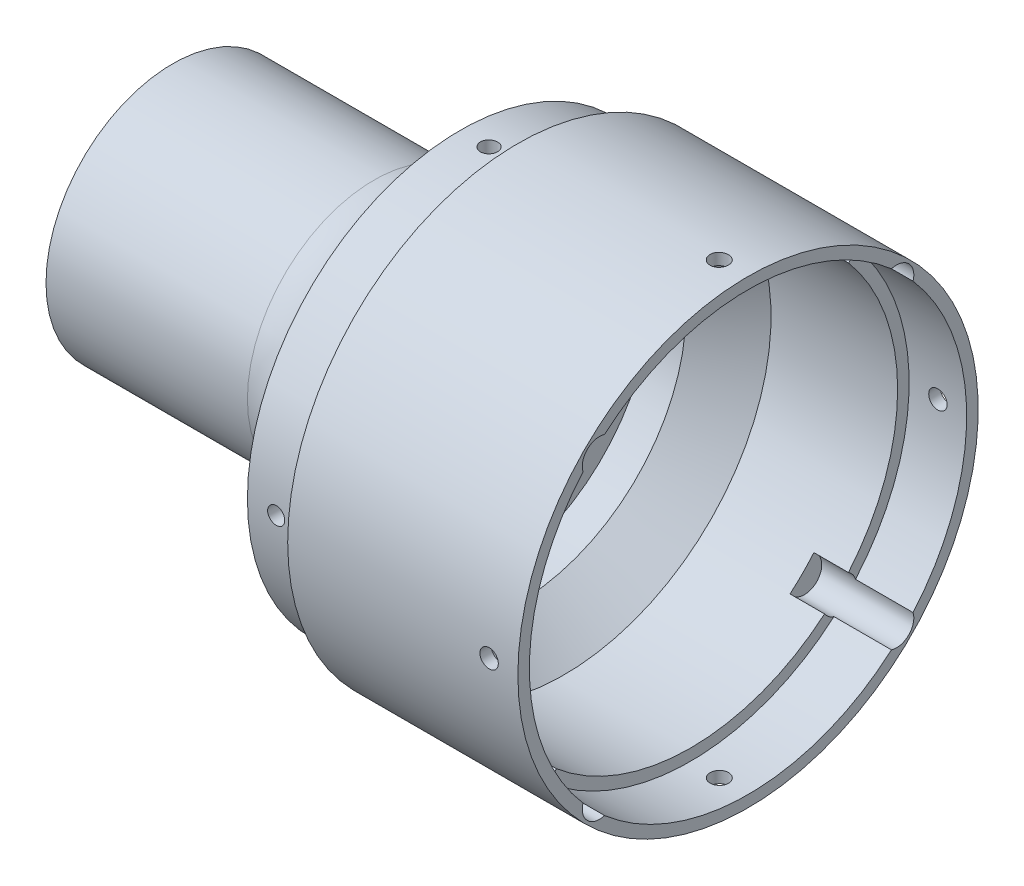
from build123d import *

# Parameters (mm, degrees)
IZIM12_R                = 1.6
KES_EKSTR_ZYON1_DEPTH   = 133.664991614
DAIRESEL_KAPLAMA1_COUNT = 6
KES_EKSTR_ZYON2_START   = 32
IZIM13_R                = 1.49
KES_EKSTR_ZYON2_DEPTH   = 5
DAIRESEL_KAPLAMA2_COUNT = 4
IZIM14_R                = 1.6
KES_EKSTR_ZYON3_DEPTH   = 133.664991614
DAIRESEL_KAPLAMA3_COUNT = 4
IZIM15_R                = 3
KES_EKSTR_ZYON5_DEPTH   = 36
DAIRESEL_KAPLAMA4_COUNT = 4
RADYUS1_R               = 15


with BuildPart() as part:
    # Çizim1 → Döndür1 (revolve)
    with BuildSketch(Plane.XY, mode=Mode.PRIVATE) as d_nd_r1_sk:
        Polygon((-60, 40), (-60, 37), (-70, 37), (-70, 22), (-120, 22), (-120, 4), (-118, 4), (-118, 18.2), (-66, 18.2), (-66, 29.2), (-60, 29.2), (-52, 36), (-30, 36), (-30, 38), (-20, 38), (-20, 40), align=None)
    revolve(d_nd_r1_sk.sketch.rotate(Axis((-88.99, 0, 0), (1, 0, 0)), 90), axis=Axis((-88.99, 0, 0), (1, 0, 0)))

    # Çizim12 → Kes-Ekstrüzyon1 (cut, through all)
    with BuildSketch(Plane(origin=(0, 0, 0), x_dir=(0, 0, -1), z_dir=(1, 0, 0))):
        with Locations((12.5, 0)):
            Circle(IZIM12_R)
    kes_ekstr_zyon1 = extrude(amount=-KES_EKSTR_ZYON1_DEPTH, mode=Mode.SUBTRACT)

    # Dairesel Kaplama1: Kes-Ekstrüzyon1 ×6 about axis
    dairesel_kaplama1_axis = Axis((0, 0, 0), (1, 0, 0))
    for i in range(1, DAIRESEL_KAPLAMA1_COUNT):
        add(kes_ekstr_zyon1.rotate(dairesel_kaplama1_axis, i * 360 / DAIRESEL_KAPLAMA1_COUNT), mode=Mode.SUBTRACT)

    # Çizim13 → Kes-Ekstrüzyon2 (cut)
    with BuildSketch(Plane.XY.offset(KES_EKSTR_ZYON2_START)):
        with Locations((-65, 0)):
            Circle(IZIM13_R)
    kes_ekstr_zyon2 = extrude(amount=KES_EKSTR_ZYON2_DEPTH, mode=Mode.SUBTRACT)

    # Dairesel Kaplama2: Kes-Ekstrüzyon2 ×4 about axis
    dairesel_kaplama2_axis = Axis((0, 0, 0), (1, 0, 0))
    for i in range(1, DAIRESEL_KAPLAMA2_COUNT):
        add(kes_ekstr_zyon2.rotate(dairesel_kaplama2_axis, i * 360 / DAIRESEL_KAPLAMA2_COUNT), mode=Mode.SUBTRACT)

    # Çizim14 → Kes-Ekstrüzyon3 (cut, through all)
    with BuildSketch(Plane.XY):
        with Locations((-25, 0)):
            Circle(IZIM14_R)
    kes_ekstr_zyon3 = extrude(amount=-KES_EKSTR_ZYON3_DEPTH, mode=Mode.SUBTRACT)

    # Dairesel Kaplama3: Kes-Ekstrüzyon3 ×4 about axis
    dairesel_kaplama3_axis = Axis((-88.99, 0, 0), (1, 0, 0))
    for i in range(1, DAIRESEL_KAPLAMA3_COUNT):
        add(kes_ekstr_zyon3.rotate(dairesel_kaplama3_axis, i * 360 / DAIRESEL_KAPLAMA3_COUNT), mode=Mode.SUBTRACT)

    # Çizim15 → Kes-Ekstrüzyon5 (cut)
    with BuildSketch(Plane(origin=(0, 0, 0), x_dir=(0, 0, -1), z_dir=(1, 0, 0))):
        with Locations((25.809397513, 25.809397513)):
            Circle(IZIM15_R)
    kes_ekstr_zyon5 = extrude(amount=-KES_EKSTR_ZYON5_DEPTH, mode=Mode.SUBTRACT)

    # Dairesel Kaplama4: Kes-Ekstrüzyon5 ×4 about axis
    dairesel_kaplama4_axis = Axis((0, 0, 0), (1, 0, 0))
    for i in range(1, DAIRESEL_KAPLAMA4_COUNT):
        add(kes_ekstr_zyon5.rotate(dairesel_kaplama4_axis, i * 360 / DAIRESEL_KAPLAMA4_COUNT), mode=Mode.SUBTRACT)

    # Radyus1
    radyus1_edges = [part.edges().sort_by_distance(p)[0] for p in [
        (-70, 0, -22),
    ]]
    fillet(radyus1_edges, radius=RADYUS1_R - 0.0001)  # a hair under: the kernel refuses the full size


solid = part.part
